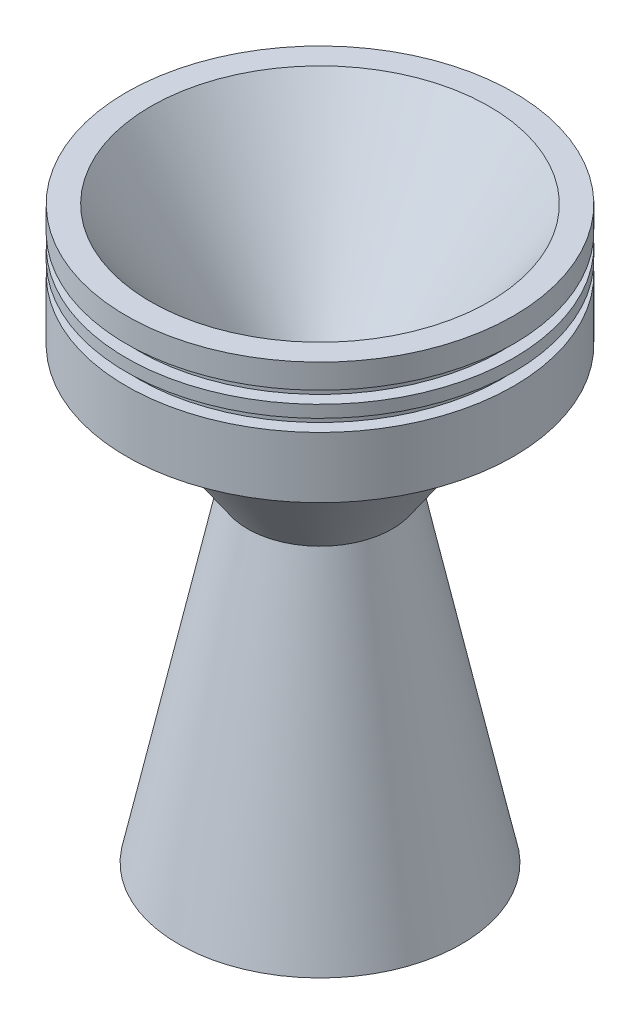
from build123d import *


with BuildPart() as part:
    # Sketch1 → base_revolve (revolve)
    with BuildSketch(Plane.XY):
        Polygon((0, 0), (2.54, 0), (16.002, -19.225728467), (16.002, -21.765728467), (7.986825192, -59.474161201), (5.446825192, -59.474161201), (12.6521595, -25.575728467), (3.81, -12.7), (0, -12.7), (0, -6.35), (1.27, -6.35), (1.27, -5.08), (0, -5.08), (0, -3.81), (1.27, -3.81), (1.27, -2.54), (0, -2.54), align=None)
    revolve(axis=Axis((20.193, 0, 0), (0, -1, 0)))


solid = part.part
